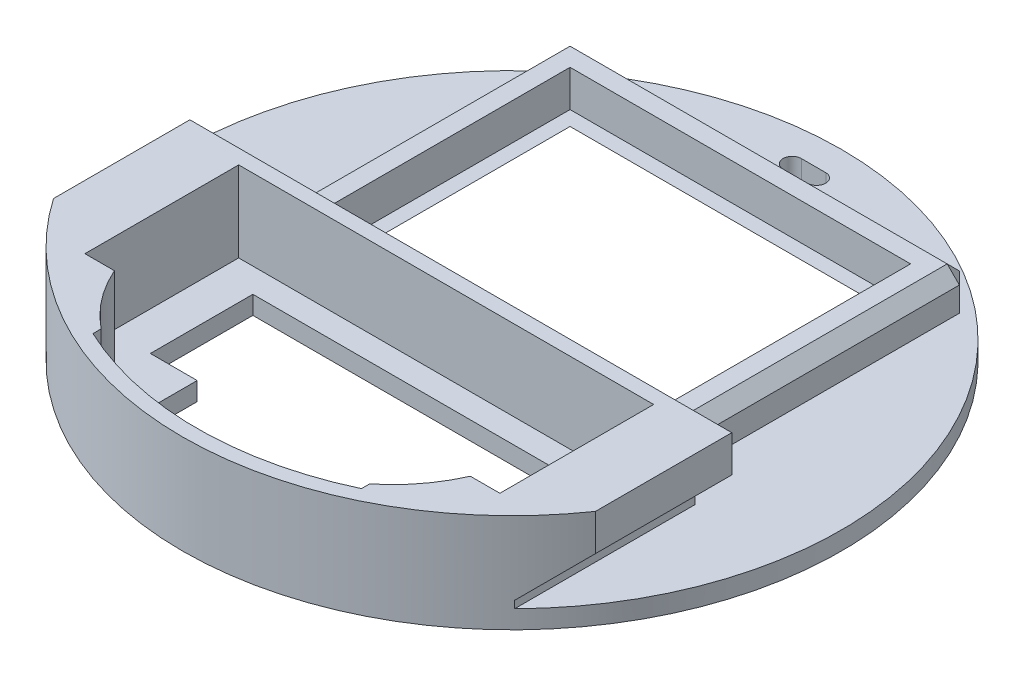
from build123d import *

# Parameters (mm, degrees)
SKETCH1_R                      = 27
SKETCH1_W                      = 25.5
SKETCH1_H                      = 17
BOSS_EXTRUDE1_DEPTH            = 1.5
BOSS_EXTRUDE2_START            = 6.6
BOSS_EXTRUDE2_DEPTH            = 6.6
CUT_EXTRUDE1_REACH             = 44.685
CUT_EXTRUDE1_END_RADIUS        = 27
CUT_EXTRUDE1_DIRECTION_2_DEPTH = 1.2
SKETCH1_5_W                    = 32.9
SKETCH1_5_H                    = 25.4
SKETCH1_5_W_2                  = 27.9
SKETCH1_5_H_2                  = 19.4
BOSS_EXTRUDE3_DEPTH            = 3
CHAMFER1_SIZE                  = 1.5
CHAMFER2_SIZE                  = 1


with BuildPart() as part:
    # Sketch1 → Boss-Extrude1 (new body)
    with BuildSketch(Plane(origin=(0, 0, 0), x_dir=(1, 0, 0), z_dir=(0, 1, 0))):
        with Locations(Location((0, 11.695639977, 0), (0, 0, 270))):
            Circle(SKETCH1_R)
        with BuildLine():
            Line((10, -4.1), (10, -12.087547362))
            ThreePointArc((10, -12.087547362), (0, -14.104360023), (-10, -12.087547362))
            Line((-10, -12.087547362), (-10, -4.1))
            Line((-10, -4.1), (-13.837653888, -4.1))
            Line((-13.837653888, -4.1), (-13.837653888, 4.3))
            Line((-13.837653888, 4.3), (13.837653888, 4.3))
            Line((13.837653888, 4.3), (13.837653888, -4.1))
            Line((13.837653888, -4.1), (10, -4.1))
        make_face(mode=Mode.SUBTRACT)
        with BuildLine():
            ThreePointArc((-1, 34.9), (-1.75, 35.65), (-1, 36.4))
            Line((-1, 36.4), (1, 36.4))
            ThreePointArc((1, 36.4), (1.75, 35.65), (1, 34.9))
            Line((1, 34.9), (-1, 34.9))
        make_face(mode=Mode.SUBTRACT)
        with Locations((0, 20.7)):
            Rectangle(SKETCH1_W, SKETCH1_H, mode=Mode.SUBTRACT)
    extrude(amount=-BOSS_EXTRUDE1_DEPTH)

    # Sketch1<3> → Boss-Extrude2 (add)
    with BuildSketch(Plane(origin=(0, 0, 0), x_dir=(1, 0, 0), z_dir=(0, 1, 0)).offset(BOSS_EXTRUDE2_START)):
        with BuildLine():
            Line((-16.45, 7.5), (-22.2, 7.5))
            Line((-22.2, 7.5), (-22.2, -3.671858193))
            ThreePointArc((-22.2, -3.671858193), (0, -15.304360023), (22.2, -3.671858193))
            Line((22.2, -3.671858193), (22.2, 7.5))
            Line((22.2, 7.5), (16.45, 7.5))
            Line((16.45, 7.5), (-16.45, 7.5))
        make_face()
        with BuildLine():
            Line((-17, -6.3), (-17, 6.3))
            Line((-17, 6.3), (17, 6.3))
            Line((17, 6.3), (17, -6.3))
            Line((17, -6.3), (14.582906959, -6.3))
            ThreePointArc((14.582906959, -6.3), (13.072174848, -8.850843183), (11, -10.971032764))
            Line((11, -10.971032764), (11, -11.641883456))
            ThreePointArc((11, -11.641883456), (10.502364214, -11.870020335), (10, -12.087547362))
            ThreePointArc((10, -12.087547362), (0, -14.104360023), (-10, -12.087547362))
            ThreePointArc((-10, -12.087547362), (-10.502364214, -11.870020335), (-11, -11.641883456))
            Line((-11, -11.641883456), (-11, -10.971032764))
            ThreePointArc((-11, -10.971032764), (-13.072174848, -8.850843183), (-14.582906959, -6.3))
            Line((-14.582906959, -6.3), (-17, -6.3))
        make_face(mode=Mode.SUBTRACT)
    extrude(amount=-BOSS_EXTRUDE2_DEPTH)

    # Cut-Extrude1: up to this cylinder (the profile starts inside it)
    cut_extrude1_end = Plane(origin=(0, 1.228571, -11.695639977), z_dir=(0, 1, 0)) * Cylinder(CUT_EXTRUDE1_END_RADIUS, 144.37, mode=Mode.PRIVATE)
    # Sketch2 → Cut-Extrude1 (cut, up to the surface)
    with BuildSketch(Plane.XY.offset(-6.3), mode=Mode.PRIVATE) as cut_extrude1_sk1:
        Polygon((-22.2, 3.6), (-19.2, 0.6), (-19.2, 0), (-22.2, 0), align=None)
    cut_extrude1_tool1 = extrude(cut_extrude1_sk1.sketch, amount=CUT_EXTRUDE1_REACH, mode=Mode.PRIVATE) & cut_extrude1_end
    add(cut_extrude1_tool1.solids().sort_by_distance((-21.057143, 1.228571, -6.3))[0], mode=Mode.SUBTRACT)
    # Sketch2 → Cut-Extrude1 (cut, up to the surface)
    with BuildSketch(Plane.XY.offset(-6.3), mode=Mode.PRIVATE) as cut_extrude1_sk2:
        Polygon((19.2, 0.6), (19.2, 0), (22.2, 0), (22.2, 3.6), align=None)
    cut_extrude1_tool2 = extrude(cut_extrude1_sk2.sketch, amount=CUT_EXTRUDE1_REACH, mode=Mode.PRIVATE) & cut_extrude1_end
    add(cut_extrude1_tool2.solids().sort_by_distance((21.057143, 1.228571, -6.3))[0], mode=Mode.SUBTRACT)

    # Sketch2 → Cut-Extrude1 direction 2 (cut)
    with BuildSketch(Plane.XY.offset(-6.3)):
        Polygon((-22.2, 3.6), (-19.2, 0.6), (-19.2, 0), (-22.2, 0), align=None)
        Polygon((19.2, 0.6), (19.2, 0), (22.2, 0), (22.2, 3.6), align=None)
    extrude(amount=-CUT_EXTRUDE1_DIRECTION_2_DEPTH, mode=Mode.SUBTRACT)

    # Sketch1<5> → Boss-Extrude3 (add)
    with BuildSketch(Plane(origin=(0, 0, 0), x_dir=(1, 0, 0), z_dir=(0, 1, 0))):
        with Locations((0, 20.2)):
            Rectangle(SKETCH1_5_W, SKETCH1_5_H)
        with Locations((0, 20.7)):
            Rectangle(SKETCH1_5_W_2, SKETCH1_5_H_2, mode=Mode.SUBTRACT)
    extrude(amount=BOSS_EXTRUDE3_DEPTH)

    # Chamfer1
    chamfer1_edges = [part.edges().sort_by_distance(p)[0] for p in [
        (-12.75, -1.5, -20.7),
        (0, -1.5, -12.2),
        (0, -1.5, -29.2),
        (12.75, -1.5, -20.7),
    ]]
    chamfer(chamfer1_edges, length=CHAMFER1_SIZE - 0.0001)  # a hair under: the kernel refuses the full size

    # Chamfer2
    chamfer2_edges = [part.edges().sort_by_distance(p)[0] for p in [
        (16.45, 3, -20.2),
        (16.45, 1.5, -7.5),
        (0, 3, -32.9),
        (16.45, 1.5, -32.9),
        (-16.45, 1.5, -32.9),
        (-16.45, 1.5, -7.5),
        (-16.45, 3, -20.2),
        (0, 3, -7.5),
    ]]
    chamfer(chamfer2_edges, length=CHAMFER2_SIZE)


solid = part.part
